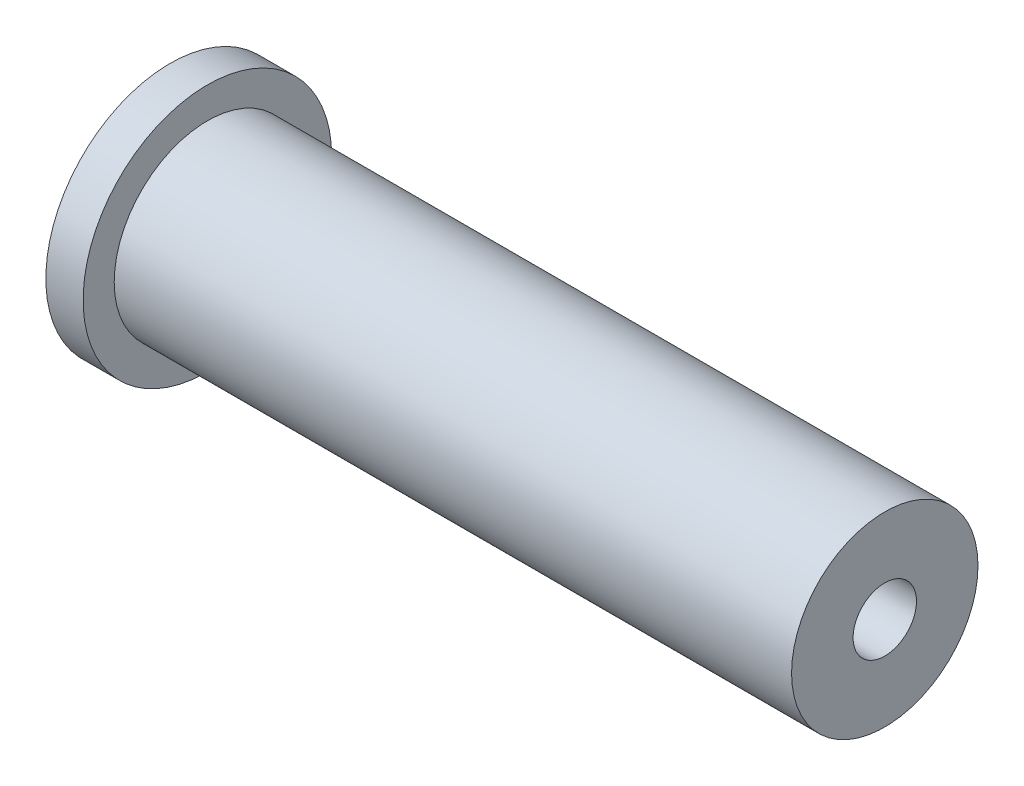
from build123d import *

# Parameters (mm, degrees)
SKETCH2_R          = 2.55
CUT_EXTRUDE1_DEPTH = 10


with BuildPart() as part:
    # Sketch1 → Revolve1 (revolve)
    with BuildSketch(Plane.XY):
        Polygon((0, 0), (0, 10), (3, 10), (3, 7.5), (57.5, 7.5), (57.5, 0), align=None)
    revolve(axis=Axis((0, 0, 0), (-1, 0, 0)))

    # Sketch2 → Cut-Extrude1 (cut)
    with BuildSketch(Plane(origin=(57.5, 0, 0), x_dir=(0, 0, -1), z_dir=(1, 0, 0))):
        Circle(SKETCH2_R)
    extrude(amount=-CUT_EXTRUDE1_DEPTH, mode=Mode.SUBTRACT)


solid = part.part
